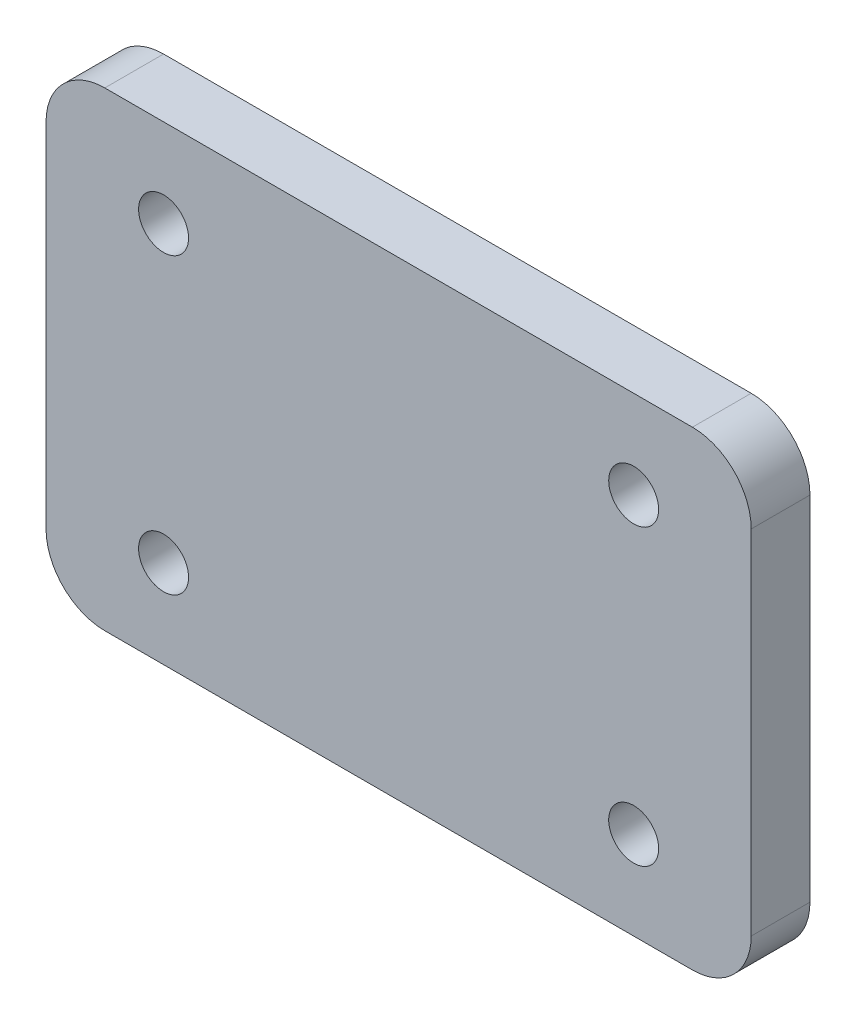
from build123d import *

# Parameters (mm, degrees)
IZIM1_W               = 120
IZIM1_H               = 80
TABAN_FLAN_1_DEPTH    = 10
IZIM6_R               = 4.25
KES_EKSTR_ZYON1_DEPTH = 20
RADYUS1_R             = 10


# Sheet-metal steps are written as plain solids
with BuildPart() as part:
    # Çizim1 → Taban-Flanş1 (new body)
    with BuildSketch(Plane.XY):
        Rectangle(IZIM1_W, IZIM1_H)
    extrude(amount=-TABAN_FLAN_1_DEPTH)

    # Çizim6 → Kes-Ekstrüzyon1 (cut)
    with BuildSketch(Plane.XY):
        with Locations((-40, 25)):
            Circle(IZIM6_R)
        with Locations((40, 25)):
            Circle(IZIM6_R)
        with Locations((40, -25)):
            Circle(IZIM6_R)
        with Locations((-40, -25)):
            Circle(IZIM6_R)
    extrude(amount=-KES_EKSTR_ZYON1_DEPTH, mode=Mode.SUBTRACT)

    # Radyus1
    radyus1_edges = [part.edges().sort_by_distance(p)[0] for p in [
        (60, -40, -5),
        (-60, -40, -5),
        (-60, 40, -5),
        (60, 40, -5),
    ]]
    fillet(radyus1_edges, radius=RADYUS1_R)


solid = part.part
